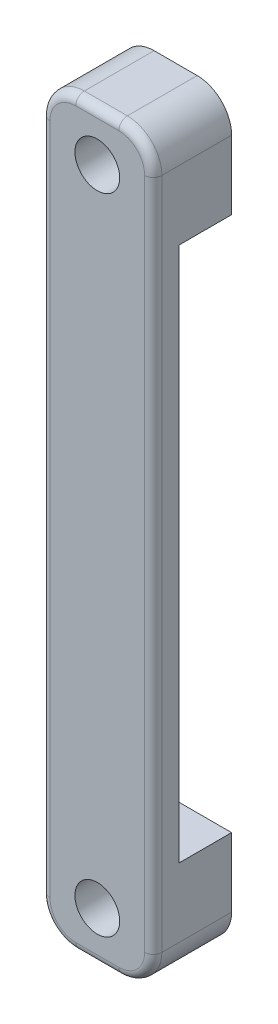
from build123d import *

# Parameters (mm, degrees)
SKETCH1_W           = 13
SKETCH1_H           = 86.15
BOSS_EXTRUDE1_DEPTH = 3
SKETCH2_W           = 13
SKETCH2_H           = 12
SKETCH2_R           = 2.6
BOSS_EXTRUDE2_DEPTH = 6.1
SKETCH2_3_R         = 2.6
CUT_EXTRUDE1_DEPTH  = 70.148871715
FILLET3_R           = 4
FILLET2_R           = 1


with BuildPart() as part:
    # Sketch1 → Boss-Extrude1 (new body)
    with BuildSketch(Plane.XY):
        with Locations((0.802799371, 25.416062051)):
            Rectangle(SKETCH1_W, SKETCH1_H)
    extrude(amount=BOSS_EXTRUDE1_DEPTH)

    # Sketch2 → Boss-Extrude2 (add)
    # profile 1 of 2: a face of its own
    with BuildSketch(Plane(origin=(0, 0, 0), x_dir=(-1, 0, 0), z_dir=(0, 0, -1))):
        with Locations((-0.802799371, -11.658937949)):
            Rectangle(SKETCH2_W, SKETCH2_H)
        with Locations((-0.802799371, -11.971437949)):
            Circle(SKETCH2_R, mode=Mode.SUBTRACT)
    # profile 2 of 2: a face of its own
    with BuildSketch(Plane(origin=(0, 0, 0), x_dir=(-1, 0, 0), z_dir=(0, 0, -1))):
        with Locations((-0.802799371, 62.491062051)):
            Rectangle(SKETCH2_W, SKETCH2_H)
        with Locations((-0.802799371, 62.803562051)):
            Circle(SKETCH2_R, mode=Mode.SUBTRACT)
    extrude(amount=BOSS_EXTRUDE2_DEPTH)

    # Sketch2<3> → Cut-Extrude1 (cut, through all)
    with BuildSketch(Plane(origin=(0, 0, 0), x_dir=(-1, 0, 0), z_dir=(0, 0, -1))):
        with Locations((-0.802799371, 62.803562051)):
            Circle(SKETCH2_3_R)
        with Locations((-0.802799371, -11.971437949)):
            Circle(SKETCH2_3_R)
    extrude(amount=-CUT_EXTRUDE1_DEPTH, mode=Mode.SUBTRACT)

    # Fillet3
    fillet3_edges = [part.edges().sort_by_distance(p)[0] for p in [
        (7.302799371, -17.658937949, -1.55),
        (-5.697200629, -17.658937949, -1.55),
        (7.302799371, 68.491062051, -1.55),
        (-5.697200629, 68.491062051, -1.55),
    ]]
    fillet(fillet3_edges, radius=FILLET3_R)

    # Fillet2
    fillet2_edges = [part.edges().sort_by_distance(p)[0] for p in [
        (-4.525627753, -16.487365074, 3),
        (-5.697200629, 25.416062051, 3),
        (-4.525627753, 67.319489176, 3),
        (0.802799371, 68.491062051, 3),
        (6.131226496, 67.319489176, 3),
        (7.302799371, 25.416062051, 3),
        (6.131226496, -16.487365074, 3),
        (0.802799371, -17.658937949, 3),
    ]]
    fillet(fillet2_edges, radius=FILLET2_R)


solid = part.part
